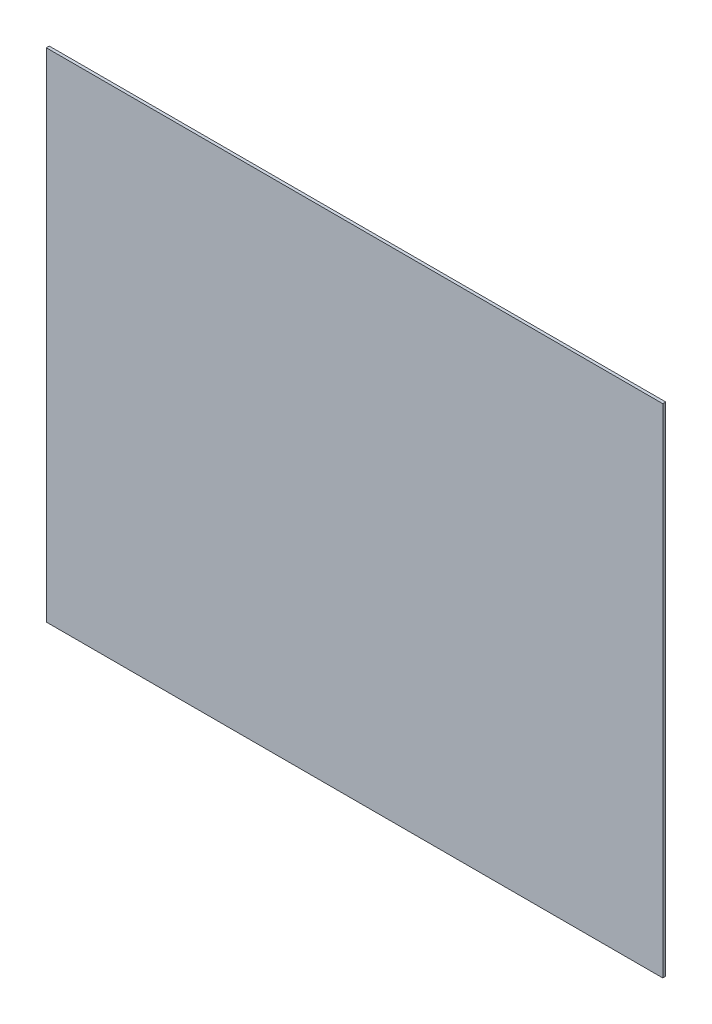
from build123d import *

# Parameters (mm, degrees)
SKETCH1_W           = 1163.2
SKETCH1_H           = 938.4
BOSS_EXTRUDE1_DEPTH = 2.794


with BuildPart() as part:
    # Sketch1 → Boss-Extrude1 (new, symmetric)
    with BuildSketch(Plane.XY):
        Rectangle(SKETCH1_W, SKETCH1_H)
    extrude(amount=BOSS_EXTRUDE1_DEPTH, both=True)


solid = part.part
